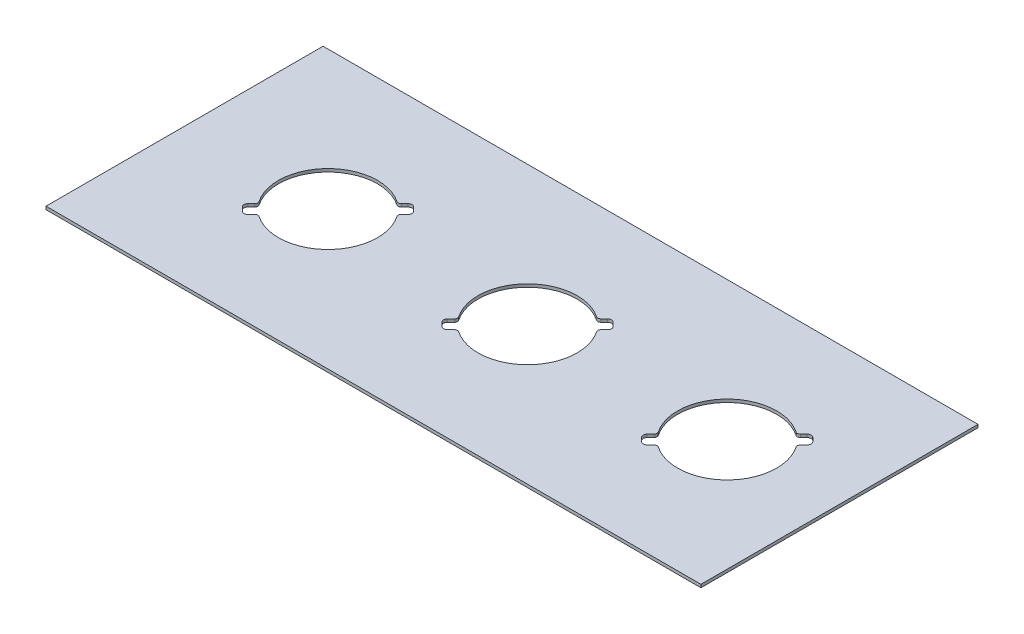
from build123d import *

# Parameters (mm, degrees)
SKETCH2_W           = 330.2
SKETCH2_H           = 139.7
BOSS_EXTRUDE1_DEPTH = 1.524


with BuildPart() as part:
    # Sketch2 → Boss-Extrude1 (new body)
    with BuildSketch(Plane(origin=(0, 0, 0), x_dir=(1, 0, 0), z_dir=(0, 1, 0))):
        Rectangle(SKETCH2_W, SKETCH2_H)
        with BuildLine():
            Line((85.95730136, -17.801083206), (87.654019166, -16.1043654))
            ThreePointArc((87.654019166, -16.1043654), (88.112068457, -15.129884007), (87.842955478, -14.087290442))
            ThreePointArc((87.842955478, -14.087290442), (90.81833047, 17.67766953), (122.583290442, 20.653044522))
            ThreePointArc((122.583290442, 20.653044522), (123.625884007, 20.383931543), (124.6003654, 20.841980834))
            Line((124.6003654, 20.841980834), (126.297083206, 22.53869864))
            ThreePointArc((126.297083206, 22.53869864), (127.711296769, 23.124485078), (129.125510331, 22.53869864))
            Line((129.125510331, 22.53869864), (131.03469864, 20.629510331))
            ThreePointArc((131.03469864, 20.629510331), (131.620485078, 19.215296769), (131.03469864, 17.801083206))
            Line((131.03469864, 17.801083206), (129.337980834, 16.1043654))
            ThreePointArc((129.337980834, 16.1043654), (128.879931543, 15.129884007), (129.149044522, 14.087290442))
            ThreePointArc((129.149044522, 14.087290442), (126.17366953, -17.67766953), (94.408709558, -20.653044522))
            ThreePointArc((94.408709558, -20.653044522), (93.366115993, -20.383931543), (92.3916346, -20.841980834))
            Line((92.3916346, -20.841980834), (90.694916794, -22.53869864))
            ThreePointArc((90.694916794, -22.53869864), (89.280703231, -23.124485078), (87.866489669, -22.53869864))
            Line((87.866489669, -22.53869864), (85.95730136, -20.629510331))
            ThreePointArc((85.95730136, -20.629510331), (85.371514922, -19.215296769), (85.95730136, -17.801083206))
        make_face(mode=Mode.SUBTRACT)
        with BuildLine():
            Line((-14.67769864, -17.801083206), (-12.980980834, -16.1043654))
            ThreePointArc((-12.980980834, -16.1043654), (-12.522931543, -15.129884007), (-12.792044522, -14.087290442))
            ThreePointArc((-12.792044522, -14.087290442), (-9.81666953, 17.67766953), (21.948290442, 20.653044522))
            ThreePointArc((21.948290442, 20.653044522), (22.990884007, 20.383931543), (23.9653654, 20.841980834))
            Line((23.9653654, 20.841980834), (25.662083206, 22.53869864))
            ThreePointArc((25.662083206, 22.53869864), (27.076296769, 23.124485078), (28.490510331, 22.53869864))
            Line((28.490510331, 22.53869864), (30.39969864, 20.629510331))
            ThreePointArc((30.39969864, 20.629510331), (30.985485078, 19.215296769), (30.39969864, 17.801083206))
            Line((30.39969864, 17.801083206), (28.702980834, 16.1043654))
            ThreePointArc((28.702980834, 16.1043654), (28.244931543, 15.129884007), (28.514044522, 14.087290442))
            ThreePointArc((28.514044522, 14.087290442), (25.53866953, -17.67766953), (-6.226290442, -20.653044522))
            ThreePointArc((-6.226290442, -20.653044522), (-7.268884007, -20.383931543), (-8.2433654, -20.841980834))
            Line((-8.2433654, -20.841980834), (-9.940083206, -22.53869864))
            ThreePointArc((-9.940083206, -22.53869864), (-11.354296769, -23.124485078), (-12.768510331, -22.53869864))
            Line((-12.768510331, -22.53869864), (-14.67769864, -20.629510331))
            ThreePointArc((-14.67769864, -20.629510331), (-15.263485078, -19.215296769), (-14.67769864, -17.801083206))
        make_face(mode=Mode.SUBTRACT)
        with BuildLine():
            Line((-115.31269864, -17.801083206), (-113.615980834, -16.1043654))
            ThreePointArc((-113.615980834, -16.1043654), (-113.157931543, -15.129884007), (-113.427044522, -14.087290442))
            ThreePointArc((-113.427044522, -14.087290442), (-110.45166953, 17.67766953), (-78.686709558, 20.653044522))
            ThreePointArc((-78.686709558, 20.653044522), (-77.644115993, 20.383931543), (-76.6696346, 20.841980834))
            Line((-76.6696346, 20.841980834), (-74.972916794, 22.53869864))
            ThreePointArc((-74.972916794, 22.53869864), (-73.558703231, 23.124485078), (-72.144489669, 22.53869864))
            Line((-72.144489669, 22.53869864), (-70.23530136, 20.629510331))
            ThreePointArc((-70.23530136, 20.629510331), (-69.649514922, 19.215296769), (-70.23530136, 17.801083206))
            Line((-70.23530136, 17.801083206), (-71.932019166, 16.1043654))
            ThreePointArc((-71.932019166, 16.1043654), (-72.390068457, 15.129884007), (-72.120955478, 14.087290442))
            ThreePointArc((-72.120955478, 14.087290442), (-75.09633047, -17.67766953), (-106.861290442, -20.653044522))
            ThreePointArc((-106.861290442, -20.653044522), (-107.903884007, -20.383931543), (-108.8783654, -20.841980834))
            Line((-108.8783654, -20.841980834), (-110.575083206, -22.53869864))
            ThreePointArc((-110.575083206, -22.53869864), (-111.989296769, -23.124485078), (-113.403510331, -22.53869864))
            Line((-113.403510331, -22.53869864), (-115.31269864, -20.629510331))
            ThreePointArc((-115.31269864, -20.629510331), (-115.898485078, -19.215296769), (-115.31269864, -17.801083206))
        make_face(mode=Mode.SUBTRACT)
    extrude(amount=BOSS_EXTRUDE1_DEPTH)


solid = part.part
